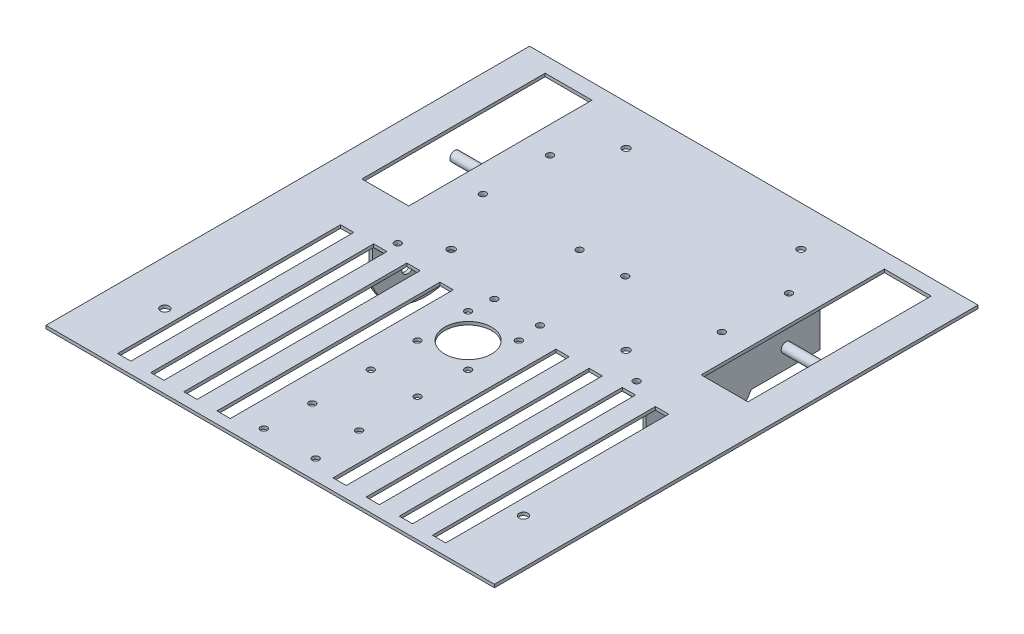
from build123d import *
from build123d.topology import SkipClean

# Parameters (mm, degrees)
SKETCH2_W           = 230
SKETCH2_H           = 248
SKETCH2_W_2         = 24
SKETCH2_H_2         = 94
BOSS_EXTRUDE1_DEPTH = 1.6
BOSS_EXTRUDE3_DEPTH = 1.6129
SKETCH6_R           = 1.27
SKETCH6_R_2         = 3
SKETCH6_R_3         = 2.55
BOSS_EXTRUDE4_DEPTH = 1.6129
SKETCH7_R           = 1.7
SKETCH7_R_2         = 1.9
SKETCH7_R_3         = 2.25
SKETCH7_W           = 6.810686888
SKETCH7_H           = 114.362783992
CUT_EXTRUDE1_DEPTH  = 10
SKETCH9_R           = 2.5
BOSS_EXTRUDE6_DEPTH = 189


with BuildPart() as part:
    # Sketch2 → Boss-Extrude1 (new body)
    with BuildSketch(Plane(origin=(0, 0, 0), x_dir=(1, 0, 0), z_dir=(0, 1, 0))):
        with Locations((-57.266187111, 35.785897091)):
            Rectangle(SKETCH2_W, SKETCH2_H)
        with Locations((29.733812889, 104.785897091)):
            Rectangle(SKETCH2_W_2, SKETCH2_H_2, mode=Mode.SUBTRACT)
        with Locations((-144.266187111, 104.785897091)):
            Rectangle(SKETCH2_W_2, SKETCH2_H_2, mode=Mode.SUBTRACT)
    extrude(amount=BOSS_EXTRUDE1_DEPTH)


with BuildPart() as body_2:
    # Sketch4 → Boss-Extrude3 (new body)
    with BuildSketch(Plane.XZ):
        Polygon((-128.266187111, -122.812619878), (-128.266187111, -33.510319411), (-110.428738975, -33.510319411), (-110.428738975, -55.404375385), (-73.179527552, -55.404375385), (-73.179527552, -32.986733746), (-64.765041143, -32.986733746), (-64.765041143, -87.177277304), (-73.179527552, -87.177277304), (-73.179527552, -65.404375385), (-110.42560363, -65.404375385), (-110.42560363, -122.812619878), align=None)
    extrude(amount=BOSS_EXTRUDE3_DEPTH)

    # Sketch6 → Boss-Extrude4 (add)
    with BuildSketch(Plane(origin=(-128.266187111, 113.834921078, 0), x_dir=(0, -1, 0), z_dir=(1, 0, 0))):
        with BuildLine():
            Line((135.588895095, 122.812619878), (113.834921078, 122.812619878))
            Line((113.834921078, 122.812619878), (113.834921078, 33.510319411))
            Line((113.834921078, 33.510319411), (132.890035435, 33.510319411))
            ThreePointArc((132.890035435, 33.510319411), (151.205721227, 59.659542549), (135.588895095, 87.504846612))
            Line((135.588895095, 87.504846612), (135.588895095, 122.812619878))
        make_face()
        with Locations((123.193301078, 51.685825385)):
            Circle(SKETCH6_R, mode=Mode.SUBTRACT)
        with Locations((133.404101078, 51.685825385)):
            Circle(SKETCH6_R_2, mode=Mode.SUBTRACT)
        with Locations((143.614901078, 51.685825385)):
            Circle(SKETCH6_R, mode=Mode.SUBTRACT)
        with Locations((133.404101078, 73.860025385)):
            Circle(SKETCH6_R, mode=Mode.SUBTRACT)
        with Locations((125.834921078, 105.412619878)):
            Circle(SKETCH6_R_3, mode=Mode.SUBTRACT)
    extrude(amount=BOSS_EXTRUDE4_DEPTH)


with BuildPart() as cut_extrude1_tool:
    # Sketch7 → Cut-Extrude1 (new body)
    with BuildSketch(Plane.XZ.offset(1.6129)):
        with Locations((-118.541013043, -82.124992621)):
            Circle(SKETCH7_R)
        with Locations((-118.541013043, -38.429929163)):
            Circle(SKETCH7_R)
        with Locations((-68.972284348, -38.429929163)):
            Circle(SKETCH7_R)
        with Locations((-68.972284348, -82.124992621)):
            Circle(SKETCH7_R)
        with Locations((-118.541013043, -116.547553094)):
            Circle(SKETCH7_R)
        with Locations((-102.118387528, -49.429929163)):
            Circle(SKETCH7_R_2)
        with Locations((-102.118387528, -139.129929163)):
            Circle(SKETCH7_R_2)
        with Locations((-149.231187111, 50.285055474)):
            Circle(SKETCH7_R_3)
        with Locations((-70.266187111, -0.279944526)):
            Circle(SKETCH7_R)
        with Locations((-70.266187111, -26.279944526)):
            Circle(SKETCH7_R)
        with Locations((-70.566187111, 78.214102909)):
            Circle(SKETCH7_R)
        with Locations((-69.266187111, 24.634898886)):
            Circle(SKETCH7_R)
        with Locations((-69.266187111, 54.634898886)):
            Circle(SKETCH7_R)
        with BuildLine():
            Line((-57.266187111, -1.279944526), (-57.266187111, -25.279944526))
            ThreePointArc((-57.266187111, -25.279944526), (-69.266187111, -13.279944526), (-57.266187111, -1.279944526))
        make_face()
        with Locations((-121.008693153, 25.186506321)):
            Rectangle(SKETCH7_W, SKETCH7_H)
        with Locations((-138.008693153, 25.186506321)):
            Rectangle(SKETCH7_W, SKETCH7_H)
        with Locations((-104.008693153, 25.186506321)):
            Rectangle(SKETCH7_W, SKETCH7_H)
        with Locations((-87.008693153, 25.186506321)):
            Rectangle(SKETCH7_W, SKETCH7_H)
    cut_extrude1 = extrude(amount=-CUT_EXTRUDE1_DEPTH)


with BuildPart() as part_1:
    add(part.part)

    # Cut-Extrude1: cut by cut_extrude1_tool
    add(cut_extrude1_tool.part, mode=Mode.SUBTRACT)

    # Mirror2: Cut-Extrude1 across plane
    with SkipClean():  # the faces are left unmerged after this step: merging them gives an invalid solid
        add(cut_extrude1.mirror(Plane(origin=(-57.266187111, 0, 0), x_dir=(0, 0, 1), z_dir=(1, 0, 0))), mode=Mode.SUBTRACT)


with BuildPart() as body_2_1:
    add(body_2.part)

    # Cut-Extrude1: cut by cut_extrude1_tool
    add(cut_extrude1_tool.part, mode=Mode.SUBTRACT)


with BuildPart() as body_3:
    # Mirror1: mirrored copy
    add(body_2_1.part.mirror(Plane(origin=(-57.266187111, 0, 0), x_dir=(0, 0, 1), z_dir=(1, 0, 0))))


with BuildPart() as body_4:
    # Sketch9 → Boss-Extrude6 (new body)
    with BuildSketch(Plane(origin=(-156.266187111, 0, 0), x_dir=(0, 0, -1), z_dir=(1, 0, 0))):
        with Locations((105.412619878, -12)):
            Circle(SKETCH9_R)
    extrude(amount=BOSS_EXTRUDE6_DEPTH)


solid = Compound([part_1.part, body_2_1.part, body_3.part, body_4.part])
